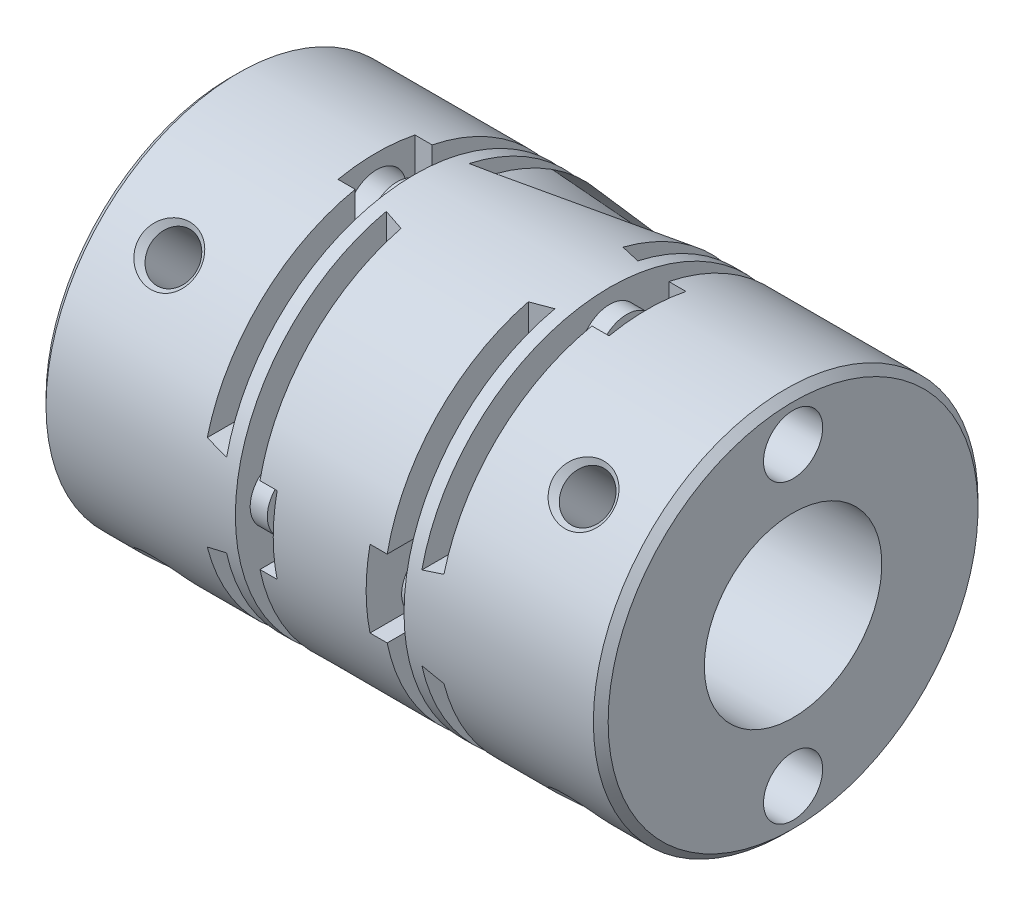
from build123d import *

# Parameters (mm, degrees)
CUT_EXTRUDE1_DEPTH      = 6.5
CUT_EXTRUDE1_DEPTH_BACK = 6.5
CUT_EXTRUDE2_DEPTH      = 6.5
CUT_EXTRUDE2_DEPTH_BACK = 6.5
CUT_EXTRUDE3_DEPTH      = 6.5
CUT_EXTRUDE3_DEPTH_BACK = 6.5
CUT_EXTRUDE4_DEPTH      = 6.5
CUT_EXTRUDE4_DEPTH_BACK = 6.5
CUT_EXTRUDE5_DEPTH      = 0.58
CUT_EXTRUDE6_DEPTH      = 0.58
CUT_EXTRUDE7_START      = 0.58
CUT_EXTRUDE7_DEPTH      = 0.58
CUT_EXTRUDE8_START      = 0.58
CUT_EXTRUDE8_DEPTH      = 0.58
CUT_EXTRUDE9_DEPTH      = 0.58
CUT_EXTRUDE10_DEPTH     = 0.58
CUT_EXTRUDE11_START     = 0.58
CUT_EXTRUDE11_DEPTH     = 0.58
CUT_EXTRUDE12_START     = 0.58
CUT_EXTRUDE12_DEPTH     = 0.58
SKETCH18_R              = 1
BOSS_EXTRUDE1_DEPTH     = 0.58
SKETCH19_R              = 1
BOSS_EXTRUDE2_DEPTH     = 0.58
SKETCH20_R              = 1
BOSS_EXTRUDE3_DEPTH     = 0.58
SKETCH21_R              = 1
BOSS_EXTRUDE4_DEPTH     = 0.58
BOSS_EXTRUDE5_START     = -0.58
SKETCH22_R              = 1
BOSS_EXTRUDE5_DEPTH     = 0.58
BOSS_EXTRUDE6_START     = -0.58
SKETCH23_R              = 1
BOSS_EXTRUDE6_DEPTH     = 0.58
BOSS_EXTRUDE7_START     = 0.58
SKETCH24_R              = 1
BOSS_EXTRUDE7_DEPTH     = 0.58
BOSS_EXTRUDE8_START     = 0.58
SKETCH25_R              = 1
BOSS_EXTRUDE8_DEPTH     = 0.58
CUT_EXTRUDE13_START     = 5.5
SKETCH26_R              = 1
CUT_EXTRUDE13_DEPTH     = 5.5
CUT_EXTRUDE14_START     = 5.5
SKETCH27_R              = 1
CUT_EXTRUDE14_DEPTH     = 5.5
SKETCH28_R              = 1
CUT_EXTRUDE15_DEPTH     = 5.5
SKETCH29_R              = 1
CUT_EXTRUDE16_DEPTH     = 5.5


with BuildPart() as part:
    # Sketch1 → Revolve1 (revolve)
    with BuildSketch(Plane.XY):
        Polygon((0, 2.5), (5.5, 2.5), (5.5, 3.5), (6.2, 3.5), (6.2, 3), (6.65, 3), (6.65, 3.5), (7.35, 3.5), (7.35, 2.75), (11.65, 2.75), (11.65, 3.5), (12.35, 3.5), (12.35, 3), (12.8, 3), (12.8, 3.5), (13.5, 3.5), (13.5, 3), (19, 3), (19, 6.25), (18.75, 6.5), (0.25, 6.5), (0, 6.25), align=None)
    revolve(axis=Axis((19, 0, 0), (-1, 0, 0)))

    # Sketch2 → Cut-Revolve1 (revolve, cut)
    with BuildSketch(Plane(origin=(2.5, 0, 0), x_dir=(0, 0, -1), z_dir=(1, 0, 0))):
        Polygon((-4.596194078, 4.596194078), (-3.889087297, 5.303300859), (-3.889087297, 4.997123623), (0.554018163, 0.554018163), (0, 0), align=None)
    revolve(axis=Axis((2.5, 0, 0), (0, 0.7071067811865476, 0.7071067811865476)), mode=Mode.SUBTRACT)

    # Sketch3 → Cut-Revolve2 (revolve, cut)
    with BuildSketch(Plane(origin=(2.5, 0, 0), x_dir=(0, 0, -1), z_dir=(1, 0, 0))):
        Polygon((-4.596194078, -4.596194078), (-5.303300859, -3.889087297), (-4.997123623, -3.889087297), (-0.554018163, 0.554018163), (0, 0), align=None)
    revolve(axis=Axis((2.5, 0, 0), (0, -0.7071067811865476, 0.7071067811865476)), mode=Mode.SUBTRACT)

    # Sketch4 → Cut-Revolve3 (revolve, cut)
    with BuildSketch(Plane(origin=(16.5, 0, 0), x_dir=(0, 0, -1), z_dir=(1, 0, 0))):
        Polygon((-4.596194078, 4.596194078), (-3.889087297, 5.303300859), (-3.889087297, 4.997123623), (0.554018163, 0.554018163), (0, 0), align=None)
    revolve(axis=Axis((16.5, 0, 0), (0, 0.7071067811865476, 0.7071067811865476)), mode=Mode.SUBTRACT)

    # Sketch5 → Cut-Revolve4 (revolve, cut)
    with BuildSketch(Plane(origin=(16.5, 0, 0), x_dir=(0, 0, -1), z_dir=(1, 0, 0))):
        Polygon((-4.596194078, -4.596194078), (-5.303300859, -3.889087297), (-4.997123623, -3.889087297), (-0.554018163, 0.554018163), (0, 0), align=None)
    revolve(axis=Axis((16.5, 0, 0), (0, -0.7071067811865476, 0.7071067811865476)), mode=Mode.SUBTRACT)

    # Sketch6 → Cut-Extrude1 (cut, two sides: drawn at the far end of the back side and taken through both)
    with BuildSketch(Plane.XY.offset(-CUT_EXTRUDE1_DEPTH_BACK)):
        Polygon((5.5, 7), (5.5, 1.6), (6.2, 1.4), (6.2, 6.5), (12.8, 6.5), (12.8, 1.4), (13.5, 1.6), (13.5, 7), align=None)
    extrude(amount=CUT_EXTRUDE1_DEPTH + CUT_EXTRUDE1_DEPTH_BACK, mode=Mode.SUBTRACT)

    # Sketch7 → Cut-Extrude2 (cut, two sides: drawn at the far end of the back side and taken through both)
    with BuildSketch(Plane.XY.offset(-CUT_EXTRUDE2_DEPTH_BACK)):
        Polygon((5.5, -7), (13.5, -7), (13.5, -1.6), (12.8, -1.4), (12.8, -6.5), (6.2, -6.5), (6.2, -1.4), (5.5, -1.6), align=None)
    extrude(amount=CUT_EXTRUDE2_DEPTH + CUT_EXTRUDE2_DEPTH_BACK, mode=Mode.SUBTRACT)

    # Sketch8 → Cut-Extrude3 (cut, two sides: drawn at the far end of the back side and taken through both)
    with BuildSketch(Plane(origin=(0, 0, 0), x_dir=(1, 0, 0), z_dir=(0, 1, 0)).offset(-CUT_EXTRUDE3_DEPTH_BACK)):
        Polygon((6.65, 7), (6.65, 1.4), (7.35, 1.6), (7.35, 6.5), (11.65, 6.5), (11.65, 1.6), (12.35, 1.4), (12.35, 7), align=None)
    extrude(amount=CUT_EXTRUDE3_DEPTH + CUT_EXTRUDE3_DEPTH_BACK, mode=Mode.SUBTRACT)

    # Sketch9 → Cut-Extrude4 (cut, two sides: drawn at the far end of the back side and taken through both)
    with BuildSketch(Plane(origin=(0, 0, 0), x_dir=(1, 0, 0), z_dir=(0, 1, 0)).offset(-CUT_EXTRUDE4_DEPTH_BACK)):
        Polygon((6.65, -7), (12.35, -7), (12.35, -1.4), (11.65, -1.6), (11.65, -6.5), (7.35, -6.5), (7.35, -1.6), (6.65, -1.4), align=None)
    extrude(amount=CUT_EXTRUDE4_DEPTH + CUT_EXTRUDE4_DEPTH_BACK, mode=Mode.SUBTRACT)

    # Sketch10 → Cut-Extrude5 (cut)
    with BuildSketch(Plane(origin=(11.65, 0, 0), x_dir=(0, 0, -1), z_dir=(1, 0, 0))):
        with BuildLine():
            Line((-6.5, -1.3), (-5, -1.3))
            ThreePointArc((-5, -1.3), (-3.7, 0), (-5, 1.3))
            Line((-5, 1.3), (-6.5, 1.3))
            Line((-6.5, 1.3), (-6.5, -1.3))
        make_face()
    extrude(amount=-CUT_EXTRUDE5_DEPTH, mode=Mode.SUBTRACT)

    # Sketch11 → Cut-Extrude6 (cut)
    with BuildSketch(Plane(origin=(11.65, 0, 0), x_dir=(0, 0, -1), z_dir=(1, 0, 0))):
        with BuildLine():
            Line((5, -1.3), (6.5, -1.3))
            Line((6.5, -1.3), (6.5, 1.3))
            Line((6.5, 1.3), (5, 1.3))
            ThreePointArc((5, 1.3), (3.7, 0), (5, -1.3))
        make_face()
    extrude(amount=-CUT_EXTRUDE6_DEPTH, mode=Mode.SUBTRACT)

    # Sketch12 → Cut-Extrude7 (cut)
    with BuildSketch(Plane(origin=(7.35, 0, 0), x_dir=(0, 0, -1), z_dir=(1, 0, 0)).offset(CUT_EXTRUDE7_START)):
        with BuildLine():
            Line((-6.5, -1.3), (-5, -1.3))
            ThreePointArc((-5, -1.3), (-3.7, 0), (-5, 1.3))
            Line((-5, 1.3), (-6.5, 1.3))
            Line((-6.5, 1.3), (-6.5, -1.3))
        make_face()
    extrude(amount=-CUT_EXTRUDE7_DEPTH, mode=Mode.SUBTRACT)

    # Sketch13 → Cut-Extrude8 (cut)
    with BuildSketch(Plane(origin=(7.35, 0, 0), x_dir=(0, 0, -1), z_dir=(1, 0, 0)).offset(CUT_EXTRUDE8_START)):
        with BuildLine():
            Line((5, -1.3), (6.5, -1.3))
            Line((6.5, -1.3), (6.5, 1.3))
            Line((6.5, 1.3), (5, 1.3))
            ThreePointArc((5, 1.3), (3.7, 0), (5, -1.3))
        make_face()
    extrude(amount=-CUT_EXTRUDE8_DEPTH, mode=Mode.SUBTRACT)

    # Sketch14 → Cut-Extrude9 (cut)
    with BuildSketch(Plane(origin=(5.5, 0, 0), x_dir=(0, 0, -1), z_dir=(1, 0, 0))):
        with BuildLine():
            Line((1.3, 5), (1.3, 6.5))
            Line((1.3, 6.5), (-1.3, 6.5))
            Line((-1.3, 6.5), (-1.3, 5))
            ThreePointArc((-1.3, 5), (0, 3.7), (1.3, 5))
        make_face()
    extrude(amount=-CUT_EXTRUDE9_DEPTH, mode=Mode.SUBTRACT)

    # Sketch15 → Cut-Extrude10 (cut)
    with BuildSketch(Plane(origin=(5.5, 0, 0), x_dir=(0, 0, -1), z_dir=(1, 0, 0))):
        with BuildLine():
            Line((-1.3, -5), (-1.3, -6.5))
            Line((-1.3, -6.5), (1.3, -6.5))
            Line((1.3, -6.5), (1.3, -5))
            ThreePointArc((1.3, -5), (0, -3.7), (-1.3, -5))
        make_face()
    extrude(amount=-CUT_EXTRUDE10_DEPTH, mode=Mode.SUBTRACT)

    # Sketch16 → Cut-Extrude11 (cut)
    with BuildSketch(Plane(origin=(13.5, 0, 0), x_dir=(0, 0, -1), z_dir=(1, 0, 0)).offset(CUT_EXTRUDE11_START)):
        with BuildLine():
            Line((1.3, 5), (1.3, 6.5))
            Line((1.3, 6.5), (-1.3, 6.5))
            Line((-1.3, 6.5), (-1.3, 5))
            ThreePointArc((-1.3, 5), (0, 3.7), (1.3, 5))
        make_face()
    extrude(amount=-CUT_EXTRUDE11_DEPTH, mode=Mode.SUBTRACT)

    # Sketch17 → Cut-Extrude12 (cut)
    with BuildSketch(Plane(origin=(13.5, 0, 0), x_dir=(0, 0, -1), z_dir=(1, 0, 0)).offset(CUT_EXTRUDE12_START)):
        with BuildLine():
            Line((-1.3, -5), (-1.3, -6.5))
            Line((-1.3, -6.5), (1.3, -6.5))
            Line((1.3, -6.5), (1.3, -5))
            ThreePointArc((1.3, -5), (0, -3.7), (-1.3, -5))
        make_face()
    extrude(amount=-CUT_EXTRUDE12_DEPTH, mode=Mode.SUBTRACT)

    # Sketch18 → Boss-Extrude1 (add)
    with BuildSketch(Plane(origin=(6.65, 0, 0), x_dir=(0, 0, -1), z_dir=(1, 0, 0))):
        with Locations((-5, 0)):
            Circle(SKETCH18_R)
    extrude(amount=BOSS_EXTRUDE1_DEPTH)

    # Sketch19 → Boss-Extrude2 (add)
    with BuildSketch(Plane(origin=(6.65, 0, 0), x_dir=(0, 0, -1), z_dir=(1, 0, 0))):
        with Locations((5, 0)):
            Circle(SKETCH19_R)
    extrude(amount=BOSS_EXTRUDE2_DEPTH)

    # Sketch20 → Boss-Extrude3 (add)
    with BuildSketch(Plane(origin=(6.2, 0, 0), x_dir=(0, 0, -1), z_dir=(1, 0, 0))):
        with Locations((0, 5)):
            Circle(SKETCH20_R)
    extrude(amount=-BOSS_EXTRUDE3_DEPTH)

    # Sketch21 → Boss-Extrude4 (add)
    with BuildSketch(Plane(origin=(6.2, 0, 0), x_dir=(0, 0, -1), z_dir=(1, 0, 0))):
        with Locations((0, -5)):
            Circle(SKETCH21_R)
    extrude(amount=-BOSS_EXTRUDE4_DEPTH)

    # Sketch22 → Boss-Extrude5 (add)
    with BuildSketch(Plane(origin=(12.35, 0, 0), x_dir=(0, 0, -1), z_dir=(1, 0, 0)).offset(BOSS_EXTRUDE5_START)):
        with Locations((-5, 0)):
            Circle(SKETCH22_R)
    extrude(amount=BOSS_EXTRUDE5_DEPTH)

    # Sketch23 → Boss-Extrude6 (add)
    with BuildSketch(Plane(origin=(12.35, 0, 0), x_dir=(0, 0, -1), z_dir=(1, 0, 0)).offset(BOSS_EXTRUDE6_START)):
        with Locations((5, 0)):
            Circle(SKETCH23_R)
    extrude(amount=BOSS_EXTRUDE6_DEPTH)

    # Sketch24 → Boss-Extrude7 (add)
    with BuildSketch(Plane(origin=(12.8, 0, 0), x_dir=(0, 0, -1), z_dir=(1, 0, 0)).offset(BOSS_EXTRUDE7_START)):
        with Locations((0, 5)):
            Circle(SKETCH24_R)
    extrude(amount=-BOSS_EXTRUDE7_DEPTH)

    # Sketch25 → Boss-Extrude8 (add)
    with BuildSketch(Plane(origin=(12.8, 0, 0), x_dir=(0, 0, -1), z_dir=(1, 0, 0)).offset(BOSS_EXTRUDE8_START)):
        with Locations((0, -5)):
            Circle(SKETCH25_R)
    extrude(amount=-BOSS_EXTRUDE8_DEPTH)

    # Sketch26 → Cut-Extrude13 (cut)
    with BuildSketch(Plane(origin=(0, 0, 0), x_dir=(0, 0, -1), z_dir=(1, 0, 0)).offset(CUT_EXTRUDE13_START)):
        with Locations((0, 5)):
            Circle(SKETCH26_R)
    extrude(amount=-CUT_EXTRUDE13_DEPTH, mode=Mode.SUBTRACT)

    # Sketch27 → Cut-Extrude14 (cut)
    with BuildSketch(Plane(origin=(0, 0, 0), x_dir=(0, 0, -1), z_dir=(1, 0, 0)).offset(CUT_EXTRUDE14_START)):
        with Locations((0, -5)):
            Circle(SKETCH27_R)
    extrude(amount=-CUT_EXTRUDE14_DEPTH, mode=Mode.SUBTRACT)

    # Sketch28 → Cut-Extrude15 (cut)
    with BuildSketch(Plane(origin=(19, 0, 0), x_dir=(0, 0, -1), z_dir=(1, 0, 0))):
        with Locations((0, 5)):
            Circle(SKETCH28_R)
    extrude(amount=-CUT_EXTRUDE15_DEPTH, mode=Mode.SUBTRACT)

    # Sketch29 → Cut-Extrude16 (cut)
    with BuildSketch(Plane(origin=(19, 0, 0), x_dir=(0, 0, -1), z_dir=(1, 0, 0))):
        with Locations((0, -5)):
            Circle(SKETCH29_R)
    extrude(amount=-CUT_EXTRUDE16_DEPTH, mode=Mode.SUBTRACT)


solid = part.part
